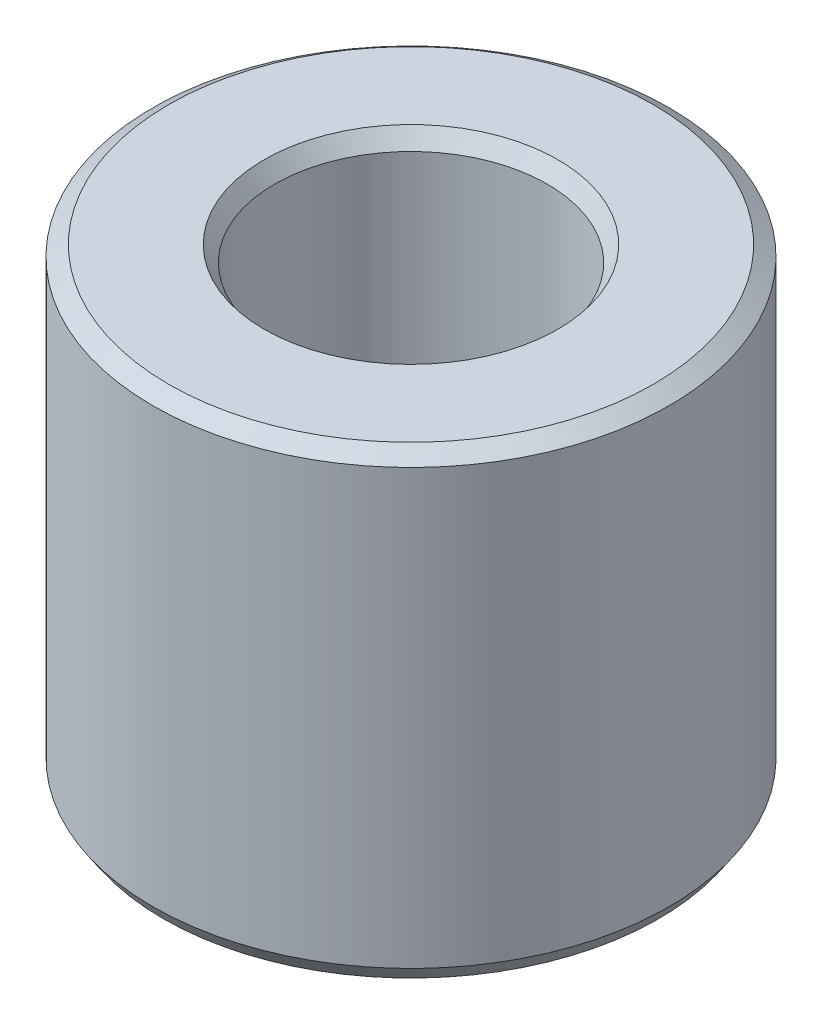
from build123d import *
from OCP.BRepFilletAPI import BRepFilletAPI_MakeChamfer

# Parameters (mm, degrees)
SKETCH1_R           = 45
BOSS_EXTRUDE1_DEPTH = 80.245694142
SKETCH2_R           = 23.75885506
CUT_EXTRUDE1_DEPTH  = 103.417632409
CHAMFER1_SIZE       = 1.851335736
CHAMFER1_SIZE2      = 2.760343686


with BuildPart() as part:
    # Sketch1 → Boss-Extrude1 (new body)
    with BuildSketch(Plane(origin=(0, 0, 0), x_dir=(1, 0, 0), z_dir=(0, 1, 0))):
        Circle(SKETCH1_R)
    extrude(amount=BOSS_EXTRUDE1_DEPTH)

    # Sketch2 → Cut-Extrude1 (cut, through all)
    with BuildSketch(Plane(origin=(0, 0, 0), x_dir=(1, 0, 0), z_dir=(0, 1, 0))):
        Circle(SKETCH2_R)
    extrude(amount=CUT_EXTRUDE1_DEPTH, mode=Mode.SUBTRACT)

    # Chamfer1: one chamfer whose edges measure the first distance from different faces: ONE call of the kernel's chamfer builder (chamfer() names one face for all edges)
    chamfer1_edges_1 = [part.edges().sort_by_distance(p)[0] for p in [
        (-23.75885506, 80.245694142, 0),
    ]]
    chamfer1_side_1 = [part.faces().sort_by_distance(p)[0] for p in [
        (-43.727207794, 80.245694142, 0),
    ]]
    chamfer1_edges_2 = [part.edges().sort_by_distance(p)[0] for p in [
        (-23.75885506, 0, 0),
    ]]
    chamfer1_side_2 = [part.faces().sort_by_distance(p)[0] for p in [
        (-23.75885506, 40.122847071, 0),
    ]]
    chamfer1_edges_3 = [part.edges().sort_by_distance(p)[0] for p in [
        (-45, 0, 0),
    ]]
    chamfer1_side_3 = [part.faces().sort_by_distance(p)[0] for p in [
        (-43.727207794, 0, 0),
    ]]
    chamfer1_edges_4 = [part.edges().sort_by_distance(p)[0] for p in [
        (-45, 80.245694142, 0),
    ]]
    chamfer1_side_4 = [part.faces().sort_by_distance(p)[0] for p in [
        (-45, 40.122847071, 0),
    ]]
    chamfer1 = BRepFilletAPI_MakeChamfer(part.part.solid().wrapped)
    for e in chamfer1_edges_1:
        chamfer1.Add(CHAMFER1_SIZE, CHAMFER1_SIZE2, e.wrapped, chamfer1_side_1[0].wrapped)  # the first distance lies on this face
    for e in chamfer1_edges_2:
        chamfer1.Add(CHAMFER1_SIZE, CHAMFER1_SIZE2, e.wrapped, chamfer1_side_2[0].wrapped)  # the first distance lies on this face
    for e in chamfer1_edges_3:
        chamfer1.Add(CHAMFER1_SIZE, CHAMFER1_SIZE2, e.wrapped, chamfer1_side_3[0].wrapped)  # the first distance lies on this face
    for e in chamfer1_edges_4:
        chamfer1.Add(CHAMFER1_SIZE, CHAMFER1_SIZE2, e.wrapped, chamfer1_side_4[0].wrapped)  # the first distance lies on this face
    add(Compound.cast(chamfer1.Shape()), mode=Mode.REPLACE)


solid = part.part
